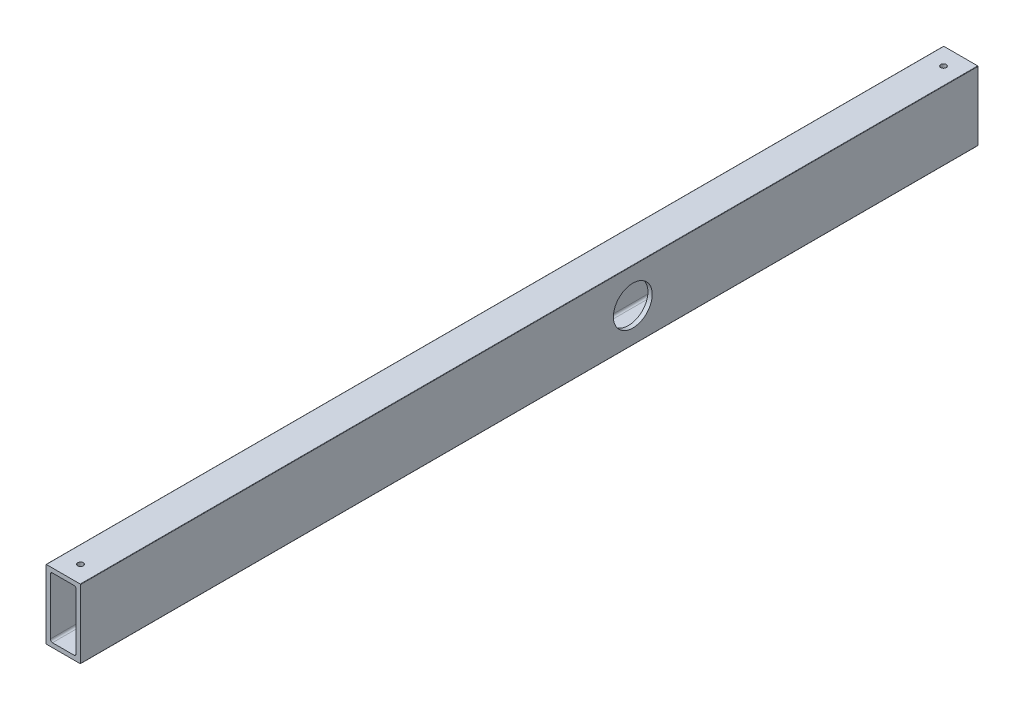
from build123d import *

# Parameters (mm, degrees)
BOSS_EXTRUDE1_DEPTH = 660.4
SKETCH2_R           = 2.032
CUT_EXTRUDE1_DEPTH  = 663.837808216
SKETCH5_R           = 14.2875
CUT_EXTRUDE2_DEPTH  = 663.837808216


with BuildPart() as part:
    # Sketch1 → Boss-Extrude1 (new body)
    with BuildSketch(Plane(origin=(0, 0, 0), x_dir=(-1, 0, 0), z_dir=(0, 0, -1))):
        with BuildLine():
            Line((0, 0.254), (0, 50.546))
            ThreePointArc((0, 50.546), (-0.074394878, 50.725605122), (-0.254, 50.8))
            Line((-0.254, 50.8), (-25.146, 50.8))
            ThreePointArc((-25.146, 50.8), (-25.325605122, 50.725605122), (-25.4, 50.546))
            Line((-25.4, 50.546), (-25.4, 0.254))
            ThreePointArc((-25.4, 0.254), (-25.325605122, 0.074394878), (-25.146, 0))
            Line((-25.146, 0), (-0.254, 0))
            ThreePointArc((-0.254, 0), (-0.074394878, 0.074394878), (0, 0.254))
        make_face()
        with BuildLine():
            Line((-3.175, 46.0375), (-3.175, 4.7625))
            ThreePointArc((-3.175, 4.7625), (-3.639967985, 3.639967985), (-4.7625, 3.175))
            Line((-4.7625, 3.175), (-20.6375, 3.175))
            ThreePointArc((-20.6375, 3.175), (-21.760032015, 3.639967985), (-22.225, 4.7625))
            Line((-22.225, 4.7625), (-22.225, 46.0375))
            ThreePointArc((-22.225, 46.0375), (-21.760032015, 47.160032015), (-20.6375, 47.625))
            Line((-20.6375, 47.625), (-4.7625, 47.625))
            ThreePointArc((-4.7625, 47.625), (-3.639967985, 47.160032015), (-3.175, 46.0375))
        make_face(mode=Mode.SUBTRACT)
    extrude(amount=-BOSS_EXTRUDE1_DEPTH)

    # Sketch2 → Cut-Extrude1 (cut, through all)
    with BuildSketch(Plane(origin=(0, 50.8, 0), x_dir=(1, 0, 0), z_dir=(0, 1, 0))):
        with Locations((12.7, -647.7)):
            Circle(SKETCH2_R)
        with Locations((12.7, -673.1)):
            Circle(SKETCH2_R)
        with Locations((12.7, 12.7)):
            Circle(SKETCH2_R)
        with Locations((12.7, -12.7)):
            Circle(SKETCH2_R)
    extrude(amount=-CUT_EXTRUDE1_DEPTH, mode=Mode.SUBTRACT)

    # Sketch5 → Cut-Extrude2 (cut, through all)
    with BuildSketch(Plane(origin=(25.4, 0, 0), x_dir=(0, 0, -1), z_dir=(1, 0, 0))):
        with Locations((-254, 25.146)):
            Circle(SKETCH5_R)
    extrude(amount=-CUT_EXTRUDE2_DEPTH, mode=Mode.SUBTRACT)


solid = part.part
